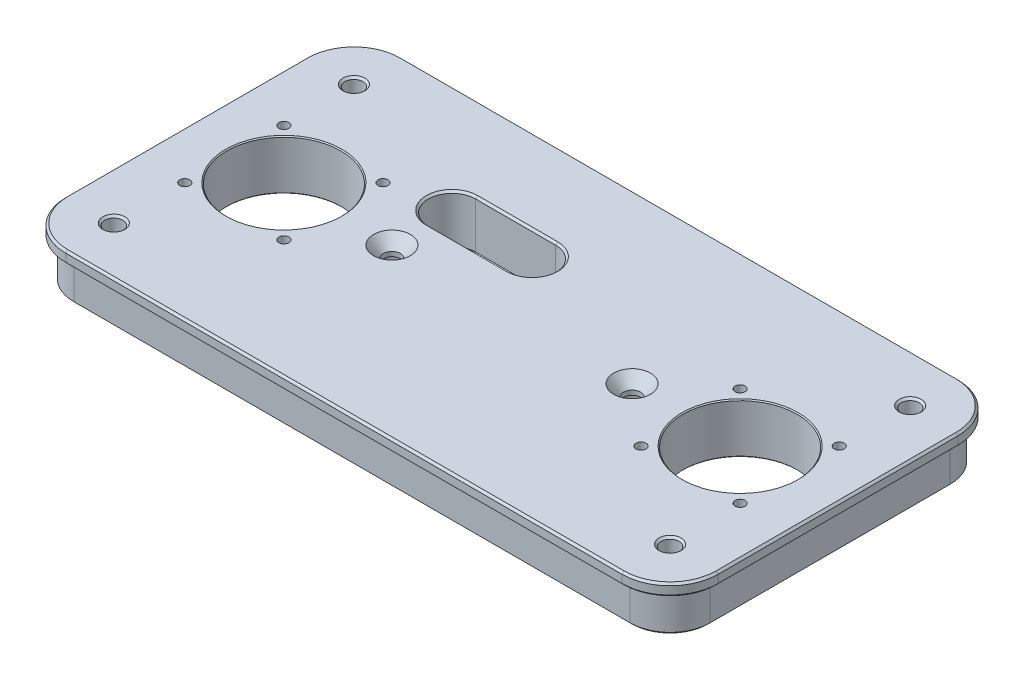
from build123d import *

# Parameters (mm, degrees)
SKETCH1_W                                            = 318
SKETCH1_H                                            = 160
BOSS_EXTRUDE1_DEPTH                                  = 25
SKETCH2_R                                            = 28.5
CUT_EXTRUDE1_DEPTH                                   = 180.738699228
CUT_EXTRUDE2_DEPTH                                   = 180.738699228
CUT_EXTRUDE2_DEPTH_BACK                              = 180.738699228
SKETCH4_R                                            = 9.55
CHAMFER1_SIZE                                        = 0.5
FILLET1_R                                            = 20
M8_CLEARANCE_HOLE1_D                                 = 9
M6X1_0_TAPPED_HOLE1_D                                = 5
SKETCH13_R                                           = 13.411040831
SKETCH13_R_2                                         = 14.724493856
BOSS_EXTRUDE3_DEPTH                                  = 8
CSK_FOR_5_16_FLAT_HEAD_SOCKET_CAP_SCREW1_D           = 8.4328
CSK_FOR_5_16_FLAT_HEAD_SOCKET_CAP_SCREW1_CSINK_D     = 18.4009792
CSK_FOR_5_16_FLAT_HEAD_SOCKET_CAP_SCREW1_CSINK_ANGLE = 82
BOSS_EXTRUDE4_DEPTH                                  = 6
CUT_EXTRUDE3_DEPTH                                   = 186.067555233
CHAMFER4_SIZE                                        = 1
M6X1_0_TAPPED_HOLE2_D                                = 5
M6X1_0_TAPPED_HOLE2_DEPTH                            = 15
M6X1_0_TAPPED_HOLE2_TIP                              = 1.502151548


with BuildPart() as part:
    # Sketch1 → Boss-Extrude1 (new body)
    with BuildSketch(Plane(origin=(0, 0, 0), x_dir=(1, 0, 0), z_dir=(0, 1, 0))):
        Rectangle(SKETCH1_W, SKETCH1_H)
    extrude(amount=BOSS_EXTRUDE1_DEPTH)

    # Sketch2 → Cut-Extrude1 (cut, through all)
    with BuildSketch(Plane(origin=(0, 25, 0), x_dir=(1, 0, 0), z_dir=(0, 1, 0))):
        with Locations((-114, 0)):
            Circle(SKETCH2_R)
        with Locations((114, 0)):
            Circle(SKETCH2_R)
    extrude(amount=-CUT_EXTRUDE1_DEPTH, mode=Mode.SUBTRACT)

    # Sketch4 → Cut-Extrude2 (cut, two sides: drawn at the far end of the back side and taken through both)
    with BuildSketch(Plane(origin=(0, 25, 0), x_dir=(1, 0, 0), z_dir=(0, 1, 0)).offset(-CUT_EXTRUDE2_DEPTH_BACK)):
        with Locations((-60, 0)):
            Circle(SKETCH4_R)
        with Locations((60, 0)):
            Circle(SKETCH4_R)
    extrude(amount=CUT_EXTRUDE2_DEPTH + CUT_EXTRUDE2_DEPTH_BACK, mode=Mode.SUBTRACT)

    # Chamfer1
    chamfer1_edges = [part.edges().sort_by_distance(p)[0] for p in [
        (85.5, 25, 0),
        (85.5, 0, 0),
        (50.45, 25, 0),
        (50.45, 0, 0),
        (-69.55, 25, 0),
        (-69.55, 0, 0),
        (-142.5, 25, 0),
        (-142.5, 0, 0),
    ]]
    chamfer(chamfer1_edges, length=CHAMFER1_SIZE)

    # Fillet1
    fillet1_edges = [part.edges().sort_by_distance(p)[0] for p in [
        (159, 12.5, 80),
        (159, 12.5, -80),
        (-159, 12.5, -80),
        (-159, 12.5, 80),
    ]]
    fillet(fillet1_edges, radius=FILLET1_R)

    # M8 Clearance Hole1 (through all)
    with Locations(Plane.XZ):
        with Locations((-139, -60), (-139, 60), (139, -60), (139, 60)):
            Hole(M8_CLEARANCE_HOLE1_D / 2)

    # M6x1.0 Tapped Hole1 (through all)
    with Locations(Plane(origin=(0, 0, 0), x_dir=(-1, 0, 0), z_dir=(0, -1, 0))):
        with Locations((138.765, -24.765), (89.235, -24.765), (89.235, 24.765), (138.765, 24.765), (-89.235, -24.765), (-138.765, -24.765), (-89.235, 24.765), (-138.765, 24.765)):
            Hole(M6X1_0_TAPPED_HOLE1_D / 2)

    # Sketch13 → Boss-Extrude3 (add)
    with BuildSketch(Plane(origin=(0, 25, 0), x_dir=(1, 0, 0), z_dir=(0, 1, 0))):
        with Locations((60, 0)):
            Circle(SKETCH13_R)
        with Locations((-60, 0)):
            Circle(SKETCH13_R_2)
    extrude(amount=-BOSS_EXTRUDE3_DEPTH)

    # CSK for 5/16 Flat Head Socket Cap Screw1 (through all)
    with Locations(Plane(origin=(0, 25, 0), x_dir=(1, 0, 0), z_dir=(0, 1, 0))):
        with Locations((60, 0), (-60, 0)):
            CounterSinkHole(CSK_FOR_5_16_FLAT_HEAD_SOCKET_CAP_SCREW1_D / 2, CSK_FOR_5_16_FLAT_HEAD_SOCKET_CAP_SCREW1_CSINK_D / 2, counter_sink_angle=CSK_FOR_5_16_FLAT_HEAD_SOCKET_CAP_SCREW1_CSINK_ANGLE)

    # Sketch16 → Boss-Extrude4 (add)
    with BuildSketch(Plane.XZ.offset(-25)):
        with BuildLine():
            Line((163, -60), (163, 60))
            ThreePointArc((163, 60), (155.970562748, 76.970562748), (139, 84))
            Line((139, 84), (-139, 84))
            ThreePointArc((-139, 84), (-155.970562748, 76.970562748), (-163, 60))
            Line((-163, 60), (-163, -60))
            ThreePointArc((-163, -60), (-155.970562748, -76.970562748), (-139, -84))
            Line((-139, -84), (139, -84))
            ThreePointArc((139, -84), (155.970562748, -76.970562748), (163, -60))
        make_face()
        with BuildLine():
            Line((159, 60), (159, -60))
            ThreePointArc((159, -60), (153.142135624, -74.142135624), (139, -80))
            Line((139, -80), (-139, -80))
            ThreePointArc((-139, -80), (-153.142135624, -74.142135624), (-159, -60))
            Line((-159, -60), (-159, 60))
            ThreePointArc((-159, 60), (-153.142135624, 74.142135624), (-139, 80))
            Line((-139, 80), (139, 80))
            ThreePointArc((139, 80), (153.142135624, 74.142135624), (159, 60))
        make_face(mode=Mode.SUBTRACT)
    extrude(amount=BOSS_EXTRUDE4_DEPTH)

    # Sketch17 → Cut-Extrude3 (cut, through all)
    with BuildSketch(Plane.XZ):
        with BuildLine():
            Line((-60, -18.184097247), (-20, -18.184097247))
            ThreePointArc((-20, -18.184097247), (-8.164859361, -30.019237886), (-20, -41.854378525))
            Line((-20, -41.854378525), (-60, -41.854378525))
            ThreePointArc((-60, -41.854378525), (-71.835140639, -30.019237886), (-60, -18.184097247))
        make_face()
    extrude(amount=-CUT_EXTRUDE3_DEPTH, mode=Mode.SUBTRACT)

    # Chamfer4
    chamfer4_edges = [part.edges().sort_by_distance(p)[0] for p in [
        (143.5, 0, -60),
        (143.5, 25, -60),
        (-134.5, 0, -60),
        (-134.5, 25, -60),
        (143.5, 0, 60),
        (143.5, 25, 60),
        (-134.5, 0, 60),
        (-134.5, 25, 60),
        (0, 19, -84),
        (155.970562748, 19, -76.970562748),
        (-155.970562748, 19, -76.970562748),
        (163, 19, 0),
        (-163, 19, 0),
        (155.970562748, 19, 76.970562748),
        (-155.970562748, 19, 76.970562748),
        (0, 19, 84),
        (0, 25, -84),
        (155.970562748, 25, -76.970562748),
        (-155.970562748, 25, -76.970562748),
        (163, 25, 0),
        (-163, 25, 0),
        (155.970562748, 25, 76.970562748),
        (-155.970562748, 25, 76.970562748),
        (0, 25, 84),
        (-40, 25, -18.184097247),
        (-71.835140639, 25, -30.019237886),
        (-8.164859361, 25, -30.019237886),
        (-40, 25, -41.854378525),
        (-40, 0, -18.184097247),
        (-71.835140639, 0, -30.019237886),
        (-8.164859361, 0, -30.019237886),
        (-40, 0, -41.854378525),
        (0, 0, -80),
        (-153.142135624, 0, -74.142135624),
        (153.142135624, 0, -74.142135624),
        (-159, 0, 0),
        (159, 0, 0),
        (-153.142135624, 0, 74.142135624),
        (153.142135624, 0, 74.142135624),
        (0, 0, 80),
    ]]
    chamfer(chamfer4_edges, length=CHAMFER4_SIZE)

    # M6x1.0 Tapped Hole2
    with Locations(Plane(origin=(0, 0, 0), x_dir=(-1, 0, 0), z_dir=(0, -1, 0))):
        with Locations((-75, 70), (-45, 70), (-105, 70), (-15, 70), (15, 70), (45, 70), (75, 70), (105, 70), (-105, -70), (-75, -70), (-45, -70), (-15, -70), (15, -70), (45, -70), (75, -70), (105, -70)):
            Hole(M6X1_0_TAPPED_HOLE2_D / 2, depth=M6X1_0_TAPPED_HOLE2_DEPTH)
            with Locations((0, 0, -(M6X1_0_TAPPED_HOLE2_DEPTH + M6X1_0_TAPPED_HOLE2_TIP / 2))):  # 118° drill point
                Cone(0, M6X1_0_TAPPED_HOLE2_D / 2, M6X1_0_TAPPED_HOLE2_TIP, mode=Mode.SUBTRACT)


solid = part.part
